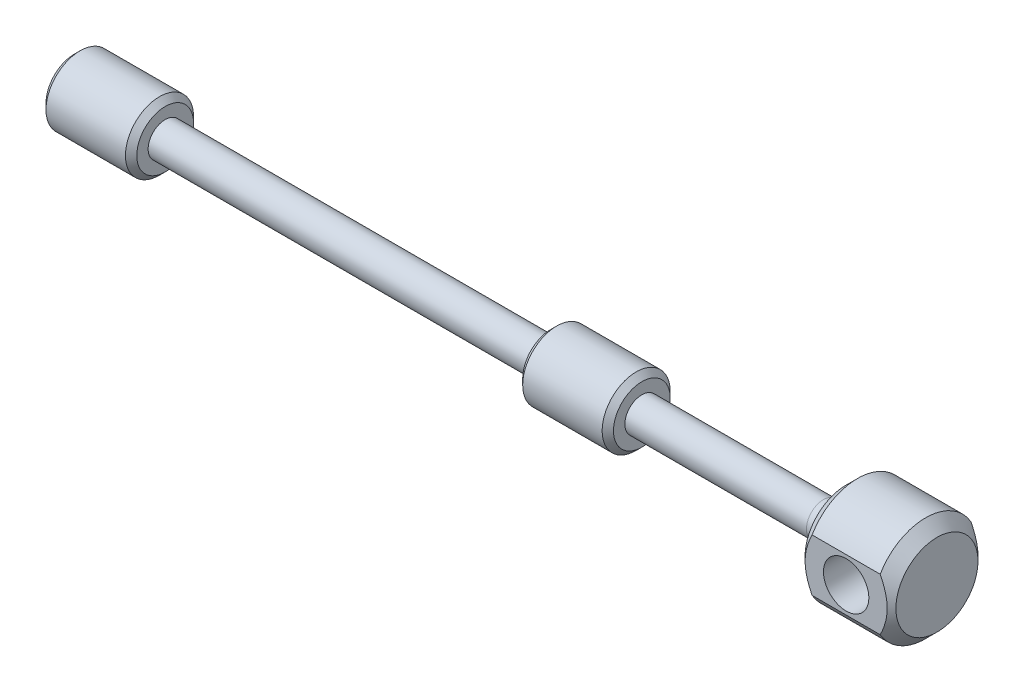
from build123d import *

# Parameters (mm, degrees)
SKETCH1_R           = 1.5
BOSS_EXTRUDE1_DEPTH = 38
SKETCH2_R           = 3
BOSS_EXTRUDE2_DEPTH = 8
BOSS_EXTRUDE3_START = -42
SKETCH2_2_R         = 3
BOSS_EXTRUDE3_DEPTH = 8
CHAMFER1_SIZE       = 0.5
SKETCH3_R           = 4.617370453
BOSS_EXTRUDE4_DEPTH = 8
CUT_EXTRUDE1_DEPTH  = 8
SKETCH5_R           = 2
CUT_EXTRUDE2_DEPTH  = 40.1065226
CHAMFER2_SIZE       = 1
FILLET1_R           = 2


with BuildPart() as part:
    # Sketch1 → Boss-Extrude1 (new, symmetric)
    with BuildSketch(Plane(origin=(0, 0, 0), x_dir=(0, 0, -1), z_dir=(1, 0, 0))):
        Circle(SKETCH1_R)
    extrude(amount=BOSS_EXTRUDE1_DEPTH, both=True)

    # Sketch2 → Boss-Extrude2 (add)
    with BuildSketch(Plane.ZY.offset(38)):
        Circle(SKETCH2_R)
    extrude(amount=-BOSS_EXTRUDE2_DEPTH)

    # Sketch2<2> → Boss-Extrude3 (add)
    with BuildSketch(Plane.ZY.offset(38).offset(BOSS_EXTRUDE3_START)):
        Circle(SKETCH2_2_R)
    extrude(amount=-BOSS_EXTRUDE3_DEPTH)

    # Chamfer1
    chamfer1_edges = [part.edges().sort_by_distance(p)[0] for p in [
        (12, 0, -3),
        (4, 0, -3),
        (-30, 0, -3),
        (-38, 0, -3),
    ]]
    chamfer(chamfer1_edges, length=CHAMFER1_SIZE)

    # Sketch3 → Boss-Extrude4 (add)
    with BuildSketch(Plane(origin=(38, 0, 0), x_dir=(0, 0, -1), z_dir=(1, 0, 0))):
        Circle(SKETCH3_R)
    extrude(amount=-BOSS_EXTRUDE4_DEPTH)

    # Sketch4 → Cut-Extrude1 (cut)
    with BuildSketch(Plane(origin=(38, 0, 0), x_dir=(0, 0, -1), z_dir=(1, 0, 0))):
        with BuildLine():
            Line((-4, 2.306536342), (-4, -2.306536342))
            ThreePointArc((-4, -2.306536342), (-4.617370453, 0), (-4, 2.306536342))
        make_face()
        with BuildLine():
            Line((4, 2.306536342), (4, -2.306536342))
            ThreePointArc((4, -2.306536342), (4.617370453, 0), (4, 2.306536342))
        make_face()
    extrude(amount=-CUT_EXTRUDE1_DEPTH, mode=Mode.SUBTRACT)

    # Sketch5 → Cut-Extrude2 (cut, through all)
    with BuildSketch(Plane.XY.offset(4)):
        with Locations((34, 0)):
            Circle(SKETCH5_R)
    extrude(amount=-CUT_EXTRUDE2_DEPTH, mode=Mode.SUBTRACT)

    # Chamfer2
    # the kernel refuses this chamfer: 1 mm, written as the material it takes off along each edge
    with BuildSketch(Plane(origin=(30, 0, 0), x_dir=(0, -0.03428839370133285, -0.9994119801450163), z_dir=(0, -0.9994119801450163, 0.03428839370133285))) as chamfer2_piece_1:
        Polygon((4.617370453 - CHAMFER2_SIZE, 0), (4.617370453, CHAMFER2_SIZE), (4.617370453, 0), align=None)
    revolve(axis=Axis((30, 0, 0), (1, 0, 0)), revolution_arc=183.929930813, mode=Mode.SUBTRACT)
    with BuildSketch(Plane(origin=(38, 0, 0), x_dir=(0, -0.0342883937013343, -0.9994119801450161), z_dir=(0, -0.9994119801450161, 0.0342883937013343))) as chamfer2_piece_2:
        Polygon((4.617370453, -CHAMFER2_SIZE), (4.617370453 - CHAMFER2_SIZE, 0), (4.617370453, 0), align=None)
    revolve(axis=Axis((38, 0, 0), (1, 0, 0)), revolution_arc=183.929930813, mode=Mode.SUBTRACT)
    with BuildSketch(Plane(origin=(38, 0, 0), x_dir=(0, 0.03428839370133442, 0.9994119801450161), z_dir=(0, 0.9994119801450161, -0.03428839370133442))) as chamfer2_piece_3:
        Polygon((4.617370453, -CHAMFER2_SIZE), (4.617370453 - CHAMFER2_SIZE, 0), (4.617370453, 0), align=None)
    revolve(axis=Axis((38, 0, 0), (1, 0, 0)), revolution_arc=183.929930813, mode=Mode.SUBTRACT)
    with BuildSketch(Plane(origin=(30, 0, 0), x_dir=(0, 0.034288393701332645, 0.9994119801450163), z_dir=(0, 0.9994119801450163, -0.034288393701332645))) as chamfer2_piece_4:
        Polygon((4.617370453 - CHAMFER2_SIZE, 0), (4.617370453, CHAMFER2_SIZE), (4.617370453, 0), align=None)
    revolve(axis=Axis((30, 0, 0), (1, 0, 0)), revolution_arc=183.929930813, mode=Mode.SUBTRACT)

    # Fillet1
    fillet1_edges = [part.edges().sort_by_distance(p)[0] for p in [
        (30, 0, 1.5),
    ]]
    fillet(fillet1_edges, radius=FILLET1_R)


solid = part.part
